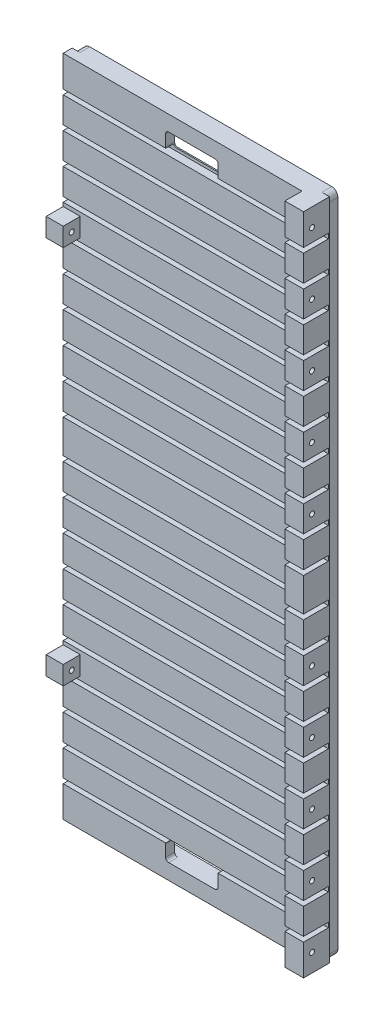
from build123d import *

# Parameters (mm, degrees)
SKETCH1_W                 = 83
SKETCH1_H                 = 214
BOSS_EXTRUDE1_DEPTH       = 8.4
SKETCH2_W                 = 77
SKETCH2_H                 = 5.5
CUT_EXTRUDE1_DEPTH        = 219.148596145
SKETCH3_W                 = 8
SKETCH3_H                 = 1.6
CUT_EXTRUDE2_DEPTH        = 136.678148572
LPATTERN1_COUNT           = 10
LPATTERN1_PITCH           = 10
MIRROR1_COPY_1_SKETCH_W   = 8
MIRROR1_COPY_1_SKETCH_H   = 1.6
MIRROR1_COPY_1_DEPTH      = 136.678148572
MIRROR1_COPY_2_SKETCH_W   = 8
MIRROR1_COPY_2_SKETCH_H   = 1.6
MIRROR1_COPY_2_DEPTH      = 136.678148572
MIRROR1_COPY_3_SKETCH_W   = 8
MIRROR1_COPY_3_SKETCH_H   = 1.6
MIRROR1_COPY_3_DEPTH      = 136.678148572
MIRROR1_COPY_4_SKETCH_W   = 8
MIRROR1_COPY_4_SKETCH_H   = 1.6
MIRROR1_COPY_4_DEPTH      = 136.678148572
MIRROR1_COPY_5_SKETCH_W   = 8
MIRROR1_COPY_5_SKETCH_H   = 1.6
MIRROR1_COPY_5_DEPTH      = 136.678148572
MIRROR1_COPY_6_SKETCH_W   = 8
MIRROR1_COPY_6_SKETCH_H   = 1.6
MIRROR1_COPY_6_DEPTH      = 136.678148572
MIRROR1_COPY_7_SKETCH_W   = 8
MIRROR1_COPY_7_SKETCH_H   = 1.6
MIRROR1_COPY_7_DEPTH      = 136.678148572
MIRROR1_COPY_8_SKETCH_W   = 8
MIRROR1_COPY_8_SKETCH_H   = 1.6
MIRROR1_COPY_8_DEPTH      = 136.678148572
MIRROR1_COPY_9_SKETCH_W   = 8
MIRROR1_COPY_9_SKETCH_H   = 1.6
MIRROR1_COPY_9_DEPTH      = 136.678148572
MIRROR1_COPY_10_SKETCH_W  = 8
MIRROR1_COPY_10_SKETCH_H  = 1.6
MIRROR1_COPY_10_DEPTH     = 136.678148572
BOSS_EXTRUDE2_DEPTH       = 3.18
SKETCH5_W                 = 5.5
SKETCH5_H                 = 6
BOSS_EXTRUDE3_DEPTH       = 5.5
CUT_EXTRUDE3_DEPTH        = 116.073063746
M2X0_4_TAPPED_HOLE1_D     = 1.6
M2X0_4_TAPPED_HOLE2_D     = 1.6
M2X0_4_TAPPED_HOLE2_DEPTH = 4
M2X0_4_TAPPED_HOLE2_TIP   = 0.480688495


with BuildPart() as part:
    # Sketch1 → Boss-Extrude1 (new body)
    with BuildSketch(Plane.XY):
        Rectangle(SKETCH1_W, SKETCH1_H)
    extrude(amount=BOSS_EXTRUDE1_DEPTH)

    # Sketch2 → Cut-Extrude1 (cut, through all)
    with BuildSketch(Plane(origin=(0, 107, 0), x_dir=(1, 0, 0), z_dir=(0, 1, 0))):
        with Locations((-3, -5.65)):
            Rectangle(SKETCH2_W, SKETCH2_H)
    extrude(amount=-CUT_EXTRUDE1_DEPTH, mode=Mode.SUBTRACT)

    # Sketch3 → Cut-Extrude2 (cut, through all)
    with BuildSketch(Plane(origin=(41.5, 0, 0), x_dir=(0, 0, -1), z_dir=(1, 0, 0))):
        with Locations((-4.4, 96.2)):
            Rectangle(SKETCH3_W, SKETCH3_H)
    cut_extrude2 = extrude(amount=-CUT_EXTRUDE2_DEPTH, mode=Mode.SUBTRACT)

    # LPattern1: Cut-Extrude2 ×10
    with Locations(*[(0, -i * LPATTERN1_PITCH, 0) for i in range(1, LPATTERN1_COUNT)]):
        add(cut_extrude2, mode=Mode.SUBTRACT)

    # Mirror1 copy 1 sketch → Mirror1 copy 1 (cut, through all)
    with BuildSketch(Plane(origin=(41.5, 10, 0), x_dir=(0, 0, -1), z_dir=(1, 0, 0))):
        with Locations((-4.4, -96.2)):
            Rectangle(MIRROR1_COPY_1_SKETCH_W, MIRROR1_COPY_1_SKETCH_H)
    extrude(amount=-MIRROR1_COPY_1_DEPTH, mode=Mode.SUBTRACT)

    # Mirror1 copy 2 sketch → Mirror1 copy 2 (cut, through all)
    with BuildSketch(Plane(origin=(41.5, 20, 0), x_dir=(0, 0, -1), z_dir=(1, 0, 0))):
        with Locations((-4.4, -96.2)):
            Rectangle(MIRROR1_COPY_2_SKETCH_W, MIRROR1_COPY_2_SKETCH_H)
    extrude(amount=-MIRROR1_COPY_2_DEPTH, mode=Mode.SUBTRACT)

    # Mirror1 copy 3 sketch → Mirror1 copy 3 (cut, through all)
    with BuildSketch(Plane(origin=(41.5, 30, 0), x_dir=(0, 0, -1), z_dir=(1, 0, 0))):
        with Locations((-4.4, -96.2)):
            Rectangle(MIRROR1_COPY_3_SKETCH_W, MIRROR1_COPY_3_SKETCH_H)
    extrude(amount=-MIRROR1_COPY_3_DEPTH, mode=Mode.SUBTRACT)

    # Mirror1 copy 4 sketch → Mirror1 copy 4 (cut, through all)
    with BuildSketch(Plane(origin=(41.5, 40, 0), x_dir=(0, 0, -1), z_dir=(1, 0, 0))):
        with Locations((-4.4, -96.2)):
            Rectangle(MIRROR1_COPY_4_SKETCH_W, MIRROR1_COPY_4_SKETCH_H)
    extrude(amount=-MIRROR1_COPY_4_DEPTH, mode=Mode.SUBTRACT)

    # Mirror1 copy 5 sketch → Mirror1 copy 5 (cut, through all)
    with BuildSketch(Plane(origin=(41.5, 50, 0), x_dir=(0, 0, -1), z_dir=(1, 0, 0))):
        with Locations((-4.4, -96.2)):
            Rectangle(MIRROR1_COPY_5_SKETCH_W, MIRROR1_COPY_5_SKETCH_H)
    extrude(amount=-MIRROR1_COPY_5_DEPTH, mode=Mode.SUBTRACT)

    # Mirror1 copy 6 sketch → Mirror1 copy 6 (cut, through all)
    with BuildSketch(Plane(origin=(41.5, 60, 0), x_dir=(0, 0, -1), z_dir=(1, 0, 0))):
        with Locations((-4.4, -96.2)):
            Rectangle(MIRROR1_COPY_6_SKETCH_W, MIRROR1_COPY_6_SKETCH_H)
    extrude(amount=-MIRROR1_COPY_6_DEPTH, mode=Mode.SUBTRACT)

    # Mirror1 copy 7 sketch → Mirror1 copy 7 (cut, through all)
    with BuildSketch(Plane(origin=(41.5, 70, 0), x_dir=(0, 0, -1), z_dir=(1, 0, 0))):
        with Locations((-4.4, -96.2)):
            Rectangle(MIRROR1_COPY_7_SKETCH_W, MIRROR1_COPY_7_SKETCH_H)
    extrude(amount=-MIRROR1_COPY_7_DEPTH, mode=Mode.SUBTRACT)

    # Mirror1 copy 8 sketch → Mirror1 copy 8 (cut, through all)
    with BuildSketch(Plane(origin=(41.5, 80, 0), x_dir=(0, 0, -1), z_dir=(1, 0, 0))):
        with Locations((-4.4, -96.2)):
            Rectangle(MIRROR1_COPY_8_SKETCH_W, MIRROR1_COPY_8_SKETCH_H)
    extrude(amount=-MIRROR1_COPY_8_DEPTH, mode=Mode.SUBTRACT)

    # Mirror1 copy 9 sketch → Mirror1 copy 9 (cut, through all)
    with BuildSketch(Plane(origin=(41.5, 90, 0), x_dir=(0, 0, -1), z_dir=(1, 0, 0))):
        with Locations((-4.4, -96.2)):
            Rectangle(MIRROR1_COPY_9_SKETCH_W, MIRROR1_COPY_9_SKETCH_H)
    extrude(amount=-MIRROR1_COPY_9_DEPTH, mode=Mode.SUBTRACT)

    # Mirror1 copy 10 sketch → Mirror1 copy 10 (cut, through all)
    with BuildSketch(Plane(origin=(41.5, 0, 0), x_dir=(0, 0, -1), z_dir=(1, 0, 0))):
        with Locations((-4.4, -96.2)):
            Rectangle(MIRROR1_COPY_10_SKETCH_W, MIRROR1_COPY_10_SKETCH_H)
    extrude(amount=-MIRROR1_COPY_10_DEPTH, mode=Mode.SUBTRACT)

    # Sketch4 → Boss-Extrude2 (add)
    with BuildSketch(Plane(origin=(0, 0, 0), x_dir=(-1, 0, 0), z_dir=(0, 0, -1))):
        with BuildLine():
            Line((-39, 107), (39, 107))
            ThreePointArc((39, 107), (40.414213562, 106.414213562), (41, 105))
            Line((41, 105), (41, -105))
            ThreePointArc((41, -105), (40.414213562, -106.414213562), (39, -107))
            Line((39, -107), (-39, -107))
            ThreePointArc((-39, -107), (-40.414213562, -106.414213562), (-41, -105))
            Line((-41, -105), (-41, 105))
            ThreePointArc((-41, 105), (-40.414213562, 106.414213562), (-39, 107))
        make_face()
        with BuildLine():
            Line((-33.5, -102), (33.5, -102))
            ThreePointArc((33.5, -102), (34.914213562, -101.414213562), (35.5, -100))
            Line((35.5, -100), (35.5, 100))
            ThreePointArc((35.5, 100), (34.914213562, 101.414213562), (33.5, 102))
            Line((33.5, 102), (-33.5, 102))
            ThreePointArc((-33.5, 102), (-34.914213562, 101.414213562), (-35.5, 100))
            Line((-35.5, 100), (-35.5, -100))
            ThreePointArc((-35.5, -100), (-34.914213562, -101.414213562), (-33.5, -102))
        make_face(mode=Mode.SUBTRACT)
    extrude(amount=BOSS_EXTRUDE2_DEPTH)

    # Sketch5 → Boss-Extrude3 (add)
    with BuildSketch(Plane.XY.offset(2.9)):
        with Locations((-38.75, 61.2)):
            Rectangle(SKETCH5_W, SKETCH5_H)
    boss_extrude3 = extrude(amount=BOSS_EXTRUDE3_DEPTH)

    # Mirror2: Boss-Extrude3 across plane
    add(boss_extrude3.mirror(Plane.ZX))

    # Sketch6 → Cut-Extrude3 (cut, through all)
    with BuildSketch(Plane(origin=(0, 0, 0), x_dir=(-1, 0, 0), z_dir=(0, 0, -1))):
        with BuildLine():
            Line((-7.475, 96.3), (7.475, 96.3))
            ThreePointArc((7.475, 96.3), (8.182106781, 96.592893219), (8.475, 97.3))
            Line((8.475, 97.3), (8.475, 101))
            ThreePointArc((8.475, 101), (8.182106781, 101.707106781), (7.475, 102))
            Line((7.475, 102), (-7.475, 102))
            ThreePointArc((-7.475, 102), (-8.182106781, 101.707106781), (-8.475, 101))
            Line((-8.475, 101), (-8.475, 97.3))
            ThreePointArc((-8.475, 97.3), (-8.182106781, 96.592893219), (-7.475, 96.3))
        make_face()
    cut_extrude3 = extrude(amount=-CUT_EXTRUDE3_DEPTH, mode=Mode.SUBTRACT)

    # Mirror3: Cut-Extrude3 across plane
    add(cut_extrude3.mirror(Plane.ZX), mode=Mode.SUBTRACT)

    # M2x0.4 Tapped Hole1 (through all)
    with Locations(Plane(origin=(41.5, 0, 0), x_dir=(0, 0, -1), z_dir=(1, 0, 0))):
        with Locations((-5.65, 101.2), (-5.65, 81.2), (-5.65, 61.2), (-5.65, 41.2), (-5.65, 21.2), (-5.65, -101.2), (-5.65, -81.2), (-5.65, -61.2), (-5.65, -41.2), (-5.65, -21.2)):
            Hole(M2X0_4_TAPPED_HOLE1_D / 2)

    # M2x0.4 Tapped Hole2
    with Locations(Plane(origin=(0, 0, -3.18), x_dir=(-1, 0, 0), z_dir=(0, 0, -1))):
        with Locations((-37.5, 101.2), (37.5, 101.2), (37.5, 81.2), (37.5, 61.2), (37.5, 41.2), (37.5, 21.2), (-37.5, 81.2), (-37.5, 61.2), (-37.5, 41.2), (-37.5, 21.2), (37.5, -101.2), (-37.5, -21.2), (-37.5, -41.2), (-37.5, -61.2), (-37.5, -81.2), (37.5, -21.2), (37.5, -41.2), (37.5, -61.2), (37.5, -81.2), (-37.5, -101.2)):
            Hole(M2X0_4_TAPPED_HOLE2_D / 2, depth=M2X0_4_TAPPED_HOLE2_DEPTH)
            with Locations((0, 0, -(M2X0_4_TAPPED_HOLE2_DEPTH + M2X0_4_TAPPED_HOLE2_TIP / 2))):  # 118° drill point
                Cone(0, M2X0_4_TAPPED_HOLE2_D / 2, M2X0_4_TAPPED_HOLE2_TIP, mode=Mode.SUBTRACT)


solid = part.part
